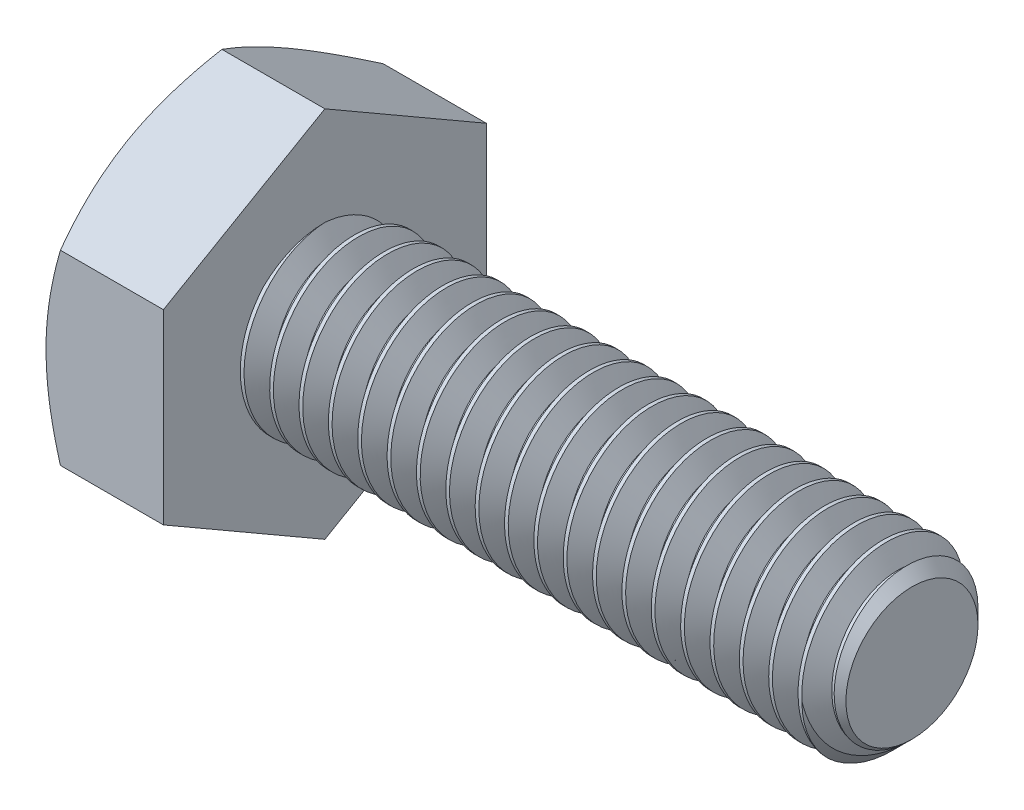
from build123d import *

# Parameters (mm, degrees)
SKETCH2_R           = 1.5
BOSS_EXTRUDE1_DEPTH = 10
CHAMFER1_SIZE       = 0.375
CUT_SWEEP1_PITCH    = 0.5
BOSS_EXTRUDE2_DEPTH = 2
SKETCH6_OUTSIDE_W   = 57.936
SKETCH6_OUTSIDE_H   = 58.786
SKETCH6_OUTSIDE_R   = 2.75
CUT_EXTRUDE1_DEPTH  = 13.714001609
CUT_EXTRUDE1_DRAFT  = -60


with BuildPart() as part:
    # Sketch2 → Boss-Extrude1 (new body)
    with BuildSketch(Plane(origin=(6, 0, 0), x_dir=(0, 0, -1), z_dir=(1, 0, 0))):
        Circle(SKETCH2_R)
    extrude(amount=-BOSS_EXTRUDE1_DEPTH)

    # Chamfer1
    chamfer1_edges = [part.edges().sort_by_distance(p)[0] for p in [
        (6, 0, 1.5),
    ]]
    chamfer(chamfer1_edges, length=CHAMFER1_SIZE)

    # Cut-Sweep1: the profile of Sketch5 profile screwed along a right-hand helix of 21 turns, 6 arcs to a turn; built about Z, then put on its axis
    cut_sweep1_z = Axis((0, 0, 0), (0, 0, 1))
    cut_sweep1_corners = [(1.5003, 0, 0.000173205), (1.175240474, 0, -0.1875), (1.175240474, 0, -0.25), (1.5003, 0, -0.437673205)]
    with BuildLine(mode=Mode.PRIVATE) as cut_sweep1_profile:
        Line(cut_sweep1_corners[0], cut_sweep1_corners[1])
        Line(cut_sweep1_corners[1], cut_sweep1_corners[2])
        Line(cut_sweep1_corners[2], cut_sweep1_corners[3])
        Line(cut_sweep1_corners[3], cut_sweep1_corners[0])
    cut_sweep1_cap = Face(cut_sweep1_profile.wire())
    cut_sweep1_turn_angles = [0, 30, 60, 90, 120, 150, 180, 210, 240, 270, 300, 330, 360]
    cut_sweep1_turn_weights = [1, 0.8660254037844387, 1, 0.8660254037844387, 1, 0.8660254037844387, 1, 0.8660254037844387, 1, 0.8660254037844387, 1, 0.8660254037844387, 1]
    cut_sweep1_turn_rails = [Edge.make_bspline([Vector(p[0], p[1], 0).rotate(cut_sweep1_z, cut_sweep1_turn_angles[k]) / cut_sweep1_turn_weights[k] + Vector(0, 0, p[2] + CUT_SWEEP1_PITCH * cut_sweep1_turn_angles[k] / 360) for k in range(13)], [0, 0, 0, 1, 1, 2, 2, 3, 3, 4, 4, 5, 5, 6, 6, 6], 2, cut_sweep1_turn_weights) for p in cut_sweep1_corners]
    cut_sweep1_turn_sides = [Face.make_surface_from_curves(cut_sweep1_turn_rails[p[0]], cut_sweep1_turn_rails[p[1]]) for p in [(0, 1), (1, 2), (2, 3), (3, 0)]]
    cut_sweep1 = Plane(origin=(6, 0, 0), x_dir=(0, 1, 0), z_dir=(-1, 0, 0)) * Solid(Shell([*[p.moved(Location((0, 0, CUT_SWEEP1_PITCH * i))) for i in range(21) for p in cut_sweep1_turn_sides], cut_sweep1_cap, cut_sweep1_cap.rotate(cut_sweep1_z, 7560).moved(Location((0, 0, CUT_SWEEP1_PITCH * 7560 / 360)))]))
    add(cut_sweep1, mode=Mode.SUBTRACT)

    # Sketch3 → Boss-Extrude2 (add)
    with BuildSketch(Plane.ZY.offset(4)):
        Polygon((-2.75, -1.58771324), (0, -3.175426481), (2.75, -1.58771324), (2.75, 1.58771324), (0, 3.175426481), (-2.75, 1.58771324), align=None)
    extrude(amount=BOSS_EXTRUDE2_DEPTH)


with BuildPart() as cut_extrude1_tool:
    # Sketch6 outside → Cut-Extrude1 (with draft: the straight prism first)
    with BuildSketch(Plane.ZY.offset(6)):
        Rectangle(SKETCH6_OUTSIDE_W, SKETCH6_OUTSIDE_H)
        Circle(SKETCH6_OUTSIDE_R, mode=Mode.SUBTRACT)
    extrude(amount=-CUT_EXTRUDE1_DEPTH)
    # Cut-Extrude1: the draft: its side faces are tilted about the plane it starts from
    cut_extrude1_sides = [cut_extrude1_tool.faces().sort_by_distance(p)[0] for p in [
        (0.857000805, -29.393, 0),
        (0.857000805, 0, 28.968),
        (0.857000805, 29.393, 0),
        (0.857000805, 0, -28.968),
        (0.857000805, 0, -2.75),
    ]]
    draft(cut_extrude1_sides, Plane.ZY.offset(6), CUT_EXTRUDE1_DRAFT)


with BuildPart() as part_1:
    add(part.part)

    # Cut-Extrude1: cut by cut_extrude1_tool
    add(cut_extrude1_tool.part, mode=Mode.SUBTRACT)


solid = part_1.part
